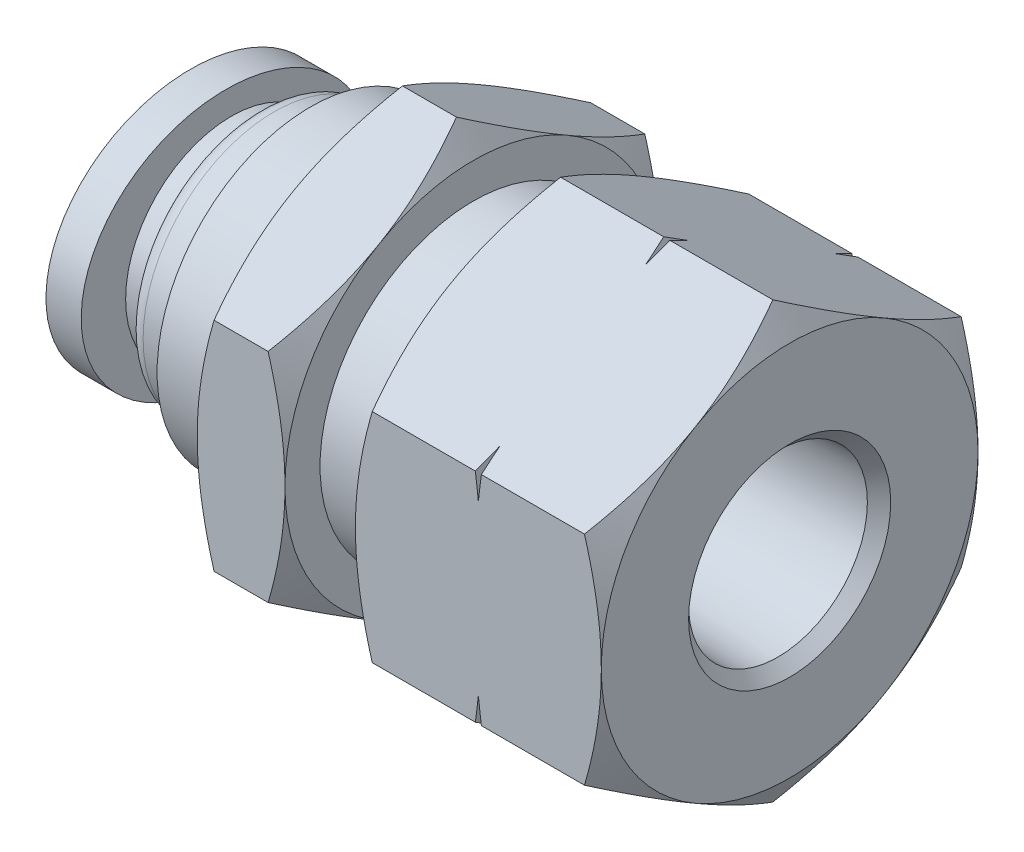
from build123d import *

# Parameters (mm, degrees)
BOSS_EXTRUDE1_DEPTH = 13.49375
CHAMFER1_SIZE       = 0.508
CHAMFER1_SIZE2      = 0.525425432
SKETCH3_RX          = 6.50875
SKETCH3_RY          = 5.6769
SKETCH3_R           = 3.3147
BOSS_EXTRUDE2_DEPTH = 1.5875


with BuildPart() as part:
    # Sketch1 → Boss-Extrude1 (new, symmetric)
    with BuildSketch(Plane(origin=(0, 0, 0), x_dir=(0, 0, -1), z_dir=(1, 0, 0))):
        Polygon((0, 9.796017487), (-8.4836, 4.898008744), (-8.4836, -4.898008744), (0, -9.796017487), (8.4836, -4.898008744), (8.4836, 4.898008744), align=None)
    extrude(amount=BOSS_EXTRUDE1_DEPTH, both=True)

    # Sketch2 → Cut-Revolve1 (revolve, cut)
    with BuildSketch(Plane.XY):
        Polygon((13.49375, 9.796017487), (13.49375, 8.4836), (12.73602541, 9.796017487), align=None)
        Polygon((3.17707459, 9.796017487), (-1.51337459, 9.796017487), (-0.75565, 8.4836), (-0.75565, 6.90245), (2.41935, 6.90245), (2.41935, 8.4836), align=None)
        Polygon((7.82043181, 9.796017487), (7.95655, 9.288017487), (8.09266819, 9.796017487), align=None)
        with BuildLine():
            Line((-3.94762541, 9.796017487), (-4.70535, 8.4836))
            Line((-4.70535, 8.4836), (-4.70535, 6.90245))
            Line((-4.70535, 6.90245), (-8.09625, 6.90245))
            Line((-8.09625, 6.90245), (-8.09625, 5.9055))
            Line((-8.09625, 5.9055), (-9.72185, 5.9055))
            ThreePointArc((-9.72185, 5.9055), (-10.260665367, 5.682315367), (-10.48385, 5.1435))
            Line((-10.48385, 5.1435), (-10.48385, 4.7625))
            Line((-10.48385, 4.7625), (-11.65225, 4.7625))
            Line((-11.65225, 4.7625), (-11.65225, 3.81))
            Line((-11.65225, 3.81), (-13.49375, 3.81))
            Line((-13.49375, 3.81), (-13.49375, 9.796017487))
            Line((-13.49375, 9.796017487), (-3.94762541, 9.796017487))
        make_face()
        Polygon((13.49375, 4.043670494), (4.19735, 3.74015), (3.497110726, 2.5273), (2.25425, 2.5273), (2.25425, 3.81), (-5.87375, 3.81), (-5.87375, 3.3147), (-13.49375, 3.3147), (-13.49375, 0), (13.49375, 0), align=None)
    revolve(axis=Axis((13.49375, 0, 0), (-1, 0, 0)), mode=Mode.SUBTRACT)

    # Chamfer1
    chamfer1_edges = [part.edges().sort_by_distance(p)[0] for p in [
        (13.49375, -4.043670494, 0),
    ]]
    chamfer1_side = [part.faces().sort_by_distance(p)[0] for p in [
        (13.49375, 8.243647556, -1.16e-07),
    ]]
    chamfer(chamfer1_edges, length=CHAMFER1_SIZE, length2=CHAMFER1_SIZE2, reference=chamfer1_side[0])

    # Sketch3 → Boss-Extrude2 (add)
    with BuildSketch(Plane.ZY.offset(13.49375)):
        with Locations(Location((0, 0), (0, 0, 180))):
            Ellipse(SKETCH3_RX, SKETCH3_RY)
        Circle(SKETCH3_R, mode=Mode.SUBTRACT)
    extrude(amount=-BOSS_EXTRUDE2_DEPTH)


solid = part.part
